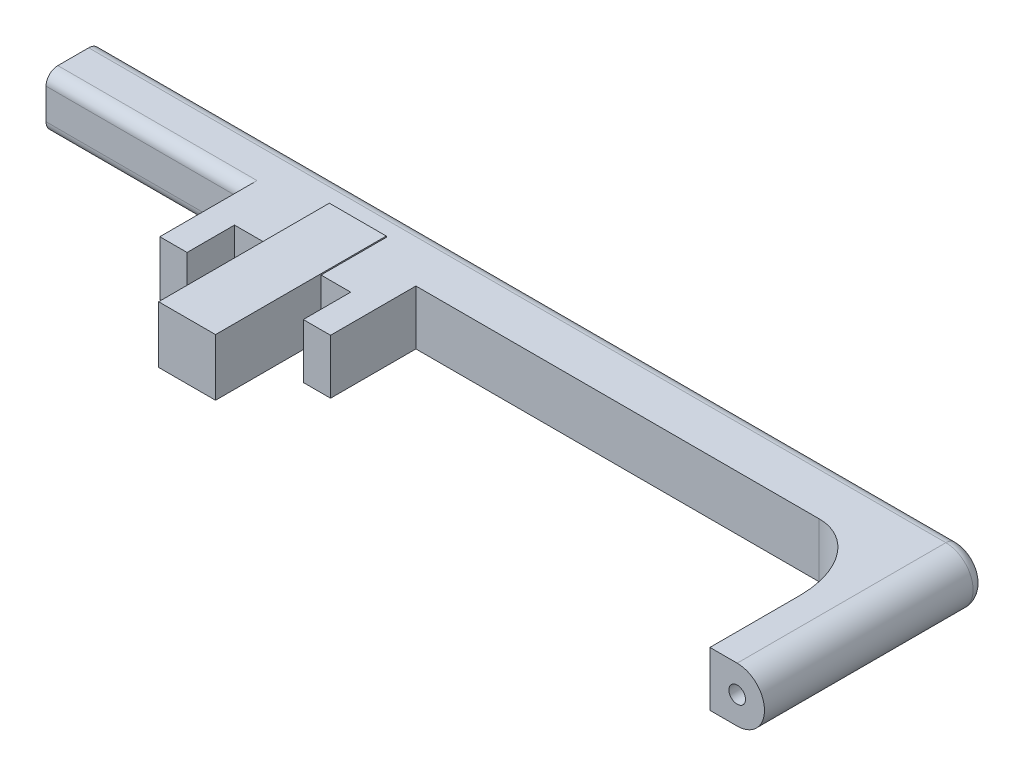
from build123d import *

# Parameters (mm, degrees)
SKETCH_1_W           = 2.4
SKETCH_1_H           = 2.4
EXTRUDE_1_DEPTH      = 7.2
EXTRUDE_2_DEPTH      = 23
EXTRUDE_2_DEPTH_BACK = 12
SKETCH_4_W           = 2.3
SKETCH_4_H           = 2.3
EXTRUDE_3_DEPTH      = 7
EXTRUDE_3_DEPTH_BACK = 2.3
SKETCH_5_R           = 0.35
SKETCH_6_R           = 0.35
CUT_EXTRUDE_1_DEPTH  = 10
FILLET_1_SIZE        = 2.4
FILLET_1_SIZE_2      = 3.2
FILLET_2_R           = 0.5
EXTRUDE_START        = -1.5
SKETCH_7_W           = 1.15
SKETCH_7_H           = 0.5
SKETCH_7_H_2         = 1.3
SKETCH_7_H_3         = 2.3
EXTRUDE_4_DEPTH      = 5.1
SKETCH_8_W           = 7.2
SKETCH_8_H           = 2.3
EXTRUDE_5_DEPTH      = 3.1


with BuildPart() as part:
    # 草图1 → 凸台-拉伸1 (new body)
    with BuildSketch(Plane.XY):
        Rectangle(SKETCH_1_W, SKETCH_1_H)
    extrude(amount=EXTRUDE_1_DEPTH)

    # 草图4 → 凸台-拉伸2 (add, two sides: drawn at the far end of the back side and taken through both)
    with BuildSketch(Plane(origin=(0, 0, 0), x_dir=(0, 0, -1), z_dir=(1, 0, 0)).offset(-EXTRUDE_2_DEPTH_BACK)):
        Rectangle(SKETCH_4_W, SKETCH_4_H)
    extrude(amount=EXTRUDE_2_DEPTH + EXTRUDE_2_DEPTH_BACK)

    # 草图5 → 凸台-拉伸3 (add, two sides: drawn at the far end of the back side and taken through both)
    with BuildSketch(Plane.XY.offset(1.15).offset(-EXTRUDE_3_DEPTH_BACK)):
        with BuildLine():
            Line((23, 0), (23, 1.15))
            Line((23, 1.15), (24.15, 1.15))
            ThreePointArc((24.15, 1.15), (25.3, 0), (24.15, -1.15))
            Line((24.15, -1.15), (23, -1.15))
            Line((23, -1.15), (23, 0))
        make_face()
        with Locations(Location((24.15, 0, 0), (0, 0, 180))):
            Circle(SKETCH_5_R, mode=Mode.SUBTRACT)
    extrude(amount=EXTRUDE_3_DEPTH + EXTRUDE_3_DEPTH_BACK)

    # 草图6 → 切除-拉伸1 (cut)
    with BuildSketch(Plane.ZY.offset(12)):
        Circle(SKETCH_6_R)
    extrude(amount=-CUT_EXTRUDE_1_DEPTH, mode=Mode.SUBTRACT)

    # 圆角1
    # an asymmetric fillet: 3.2, 2.4 mm, written as the material it adds along each edge
    with BuildSketch(Plane(origin=(23, 1.15, 1.15), x_dir=(-1, 0, 0), z_dir=(0, -1, 0))) as fillet_1_piece_1:
        with BuildLine():
            Bezier((FILLET_1_SIZE, 0), (0, 0), (0, -FILLET_1_SIZE_2), weights=[1, 0.707106781, 1])
            Line((0, -FILLET_1_SIZE_2), (0, 0))
            Line((0, 0), (FILLET_1_SIZE, 0))
        make_face()
    extrude(amount=2.3)

    # 圆角2
    fillet_2_edges = [part.edges().sort_by_distance(p)[0] for p in [
        (-6.6, -1.15, 1.15),
        (6.075, -1.15, -1.15),
        (-6.6, 1.15, 1.15),
        (6.075, 1.15, -1.15),
        (25.3, 0, -1.15),
    ]]
    fillet(fillet_2_edges, radius=FILLET_2_R)

    # 草图7 → 凸台-拉伸4 (add)
    with BuildSketch(Plane.XY.offset(1.15).offset(EXTRUDE_START)):
        with Locations((-3.025, 0.9)):
            Rectangle(SKETCH_7_W, SKETCH_7_H)
        with Locations((-3.025, 0)):
            Rectangle(SKETCH_7_W, SKETCH_7_H_2)
        with Locations((-3.025, -0.9)):
            Rectangle(SKETCH_7_W, SKETCH_7_H)
        with Locations((3.025, 0)):
            Rectangle(SKETCH_7_W, SKETCH_7_H_3)
    extrude(amount=EXTRUDE_4_DEPTH)

    # 草图8 → 凸台-拉伸5 (add)
    with BuildSketch(Plane.XY.offset(1.15).offset(EXTRUDE_START)):
        Rectangle(SKETCH_8_W, SKETCH_8_H)
    extrude(amount=EXTRUDE_5_DEPTH)


solid = part.part
